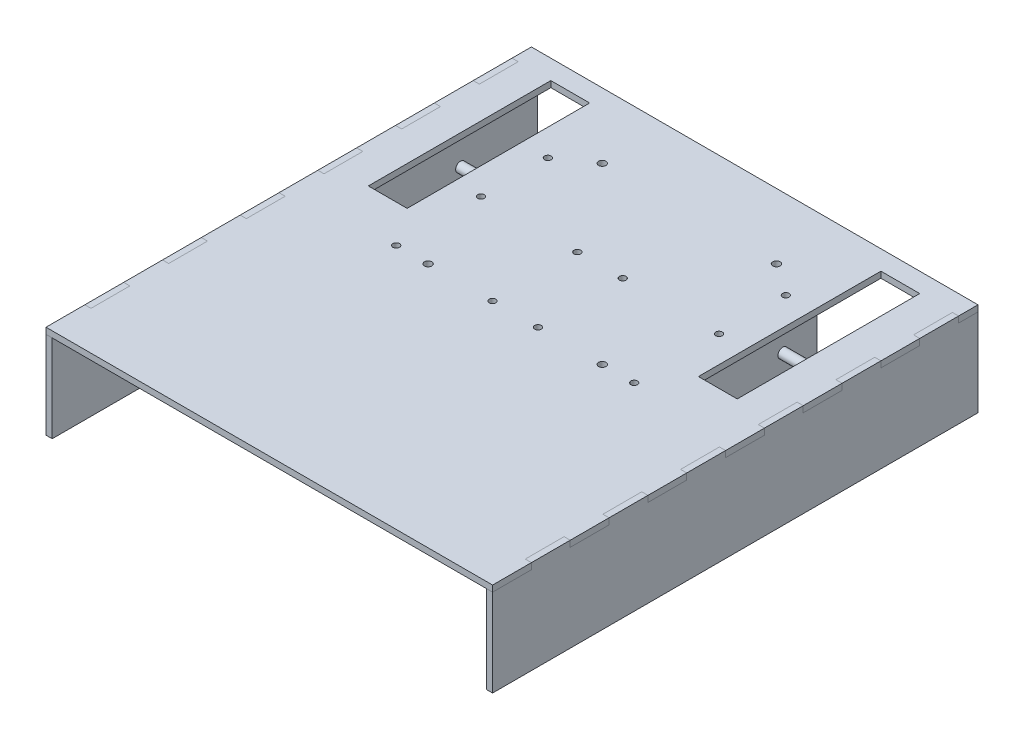
from build123d import *

# Parameters (mm, degrees)
SKETCH2_W           = 20
SKETCH2_H           = 94
BOSS_EXTRUDE1_DEPTH = 3.175
BOSS_EXTRUDE2_DEPTH = 3.175
BOSS_EXTRUDE3_DEPTH = 1.6129
SKETCH6_R           = 1.27
SKETCH6_R_2         = 2.3749
SKETCH6_R_3         = 2.55
BOSS_EXTRUDE4_DEPTH = 1.6129
SKETCH7_R           = 1.7
SKETCH7_R_2         = 1.9
CUT_EXTRUDE1_DEPTH  = 10
SKETCH9_R           = 2.5
BOSS_EXTRUDE6_DEPTH = 189


with BuildPart() as part:
    # Sketch2 → Boss-Extrude1 (new body)
    with BuildSketch(Plane(origin=(0, 0, 0), x_dir=(1, 0, 0), z_dir=(0, 1, 0))):
        Polygon((-172.266187111, -88.214102909), (57.733812889, -88.214102909), (57.733812889, -68.214102909), (54.558812889, -68.214102909), (54.558812889, -48.214102909), (57.733812889, -48.214102909), (57.733812889, -28.214102909), (54.558812889, -28.214102909), (54.558812889, -8.214102909), (57.733812889, -8.214102909), (57.733812889, 11.785897091), (54.558812889, 11.785897091), (54.558812889, 31.785897091), (57.733812889, 31.785897091), (57.733812889, 51.785897091), (54.558812889, 51.785897091), (54.558812889, 71.785897091), (57.733812889, 71.785897091), (57.733812889, 91.785897091), (54.558812889, 91.785897091), (54.558812889, 111.785897091), (57.733812889, 111.785897091), (57.733812889, 131.785897091), (54.558812889, 131.785897091), (54.558812889, 151.785897091), (57.733812889, 151.785897091), (57.733812889, 161.785897091), (-172.266187111, 161.785897091), (-172.266187111, 151.785897091), (-169.091187111, 151.785897091), (-169.091187111, 131.785897091), (-172.266187111, 131.785897091), (-172.266187111, 111.785897091), (-169.091187111, 111.785897091), (-169.091187111, 91.785897091), (-172.266187111, 91.785897091), (-172.266187111, 71.785897091), (-169.091187111, 71.785897091), (-169.091187111, 51.785897091), (-172.266187111, 51.785897091), (-172.266187111, 31.785897091), (-169.091187111, 31.785897091), (-169.091187111, 11.785897091), (-172.266187111, 11.785897091), (-172.266187111, -8.214102909), (-169.091187111, -8.214102909), (-169.091187111, -28.214102909), (-172.266187111, -28.214102909), (-172.266187111, -48.214102909), (-169.091187111, -48.214102909), (-169.091187111, -68.214102909), (-172.266187111, -68.214102909), align=None)
        with Locations((27.733812889, 104.785897091)):
            Rectangle(SKETCH2_W, SKETCH2_H, mode=Mode.SUBTRACT)
        with Locations((-142.266187111, 104.785897091)):
            Rectangle(SKETCH2_W, SKETCH2_H, mode=Mode.SUBTRACT)
    extrude(amount=BOSS_EXTRUDE1_DEPTH)


with BuildPart() as body_2:
    # Sketch3 → Boss-Extrude2 (new body)
    with BuildSketch(Plane.ZY.offset(169.091187111)):
        Polygon((68.214102909, 3.175), (68.214102909, 0), (88.214102909, 0), (88.214102909, -45), (-161.732040232, -45), (-161.732040232, 0), (-151.785897091, 0), (-151.785897091, 3.175), (-131.785897091, 3.175), (-131.785897091, 0), (-111.785897091, 0), (-111.785897091, 3.175), (-91.785897091, 3.175), (-91.785897091, 0), (-71.785897091, 0), (-71.785897091, 3.175), (-51.785897091, 3.175), (-51.785897091, 0), (-31.785897091, 0), (-31.785897091, 3.175), (-11.785897091, 3.175), (-11.785897091, 0), (8.214102909, 0), (8.214102909, 3.175), (28.214102909, 3.175), (28.214102909, 0), (48.214102909, 0), (48.214102909, 3.175), align=None)
    extrude(amount=BOSS_EXTRUDE2_DEPTH)


with BuildPart() as body_3:
    # Sketch4 → Boss-Extrude3 (new body)
    with BuildSketch(Plane.XZ):
        Polygon((-128.266187111, -122.812619878), (-128.266187111, -33.510319411), (-110.428738975, -33.510319411), (-110.428738975, -55.404375385), (-73.179527552, -55.404375385), (-73.179527552, -32.986733746), (-64.765041143, -32.986733746), (-64.765041143, -87.177277304), (-73.179527552, -87.177277304), (-73.179527552, -65.404375385), (-110.42560363, -65.404375385), (-110.42560363, -122.812619878), align=None)
    extrude(amount=BOSS_EXTRUDE3_DEPTH)

    # Sketch6 → Boss-Extrude4 (add)
    with BuildSketch(Plane(origin=(-128.266187111, 113.834921078, 0), x_dir=(0, -1, 0), z_dir=(1, 0, 0))):
        with BuildLine():
            Line((135.755040524, 122.812619878), (113.834921078, 122.812619878))
            Line((113.834921078, 122.812619878), (113.834921078, 33.510319411))
            Line((113.834921078, 33.510319411), (133.404101078, 33.510319411))
            ThreePointArc((133.404101078, 33.510319411), (151.380719154, 59.699448377), (135.755040524, 87.355685301))
            Line((135.755040524, 87.355685301), (135.755040524, 122.812619878))
        make_face()
        with Locations((123.193301078, 51.685825385)):
            Circle(SKETCH6_R, mode=Mode.SUBTRACT)
        with Locations((133.404101078, 51.685825385)):
            Circle(SKETCH6_R_2, mode=Mode.SUBTRACT)
        with Locations((143.614901078, 51.685825385)):
            Circle(SKETCH6_R, mode=Mode.SUBTRACT)
        with Locations((133.404101078, 73.860025385)):
            Circle(SKETCH6_R, mode=Mode.SUBTRACT)
        with Locations((125.834921078, 105.254818177)):
            Circle(SKETCH6_R_3, mode=Mode.SUBTRACT)
    extrude(amount=BOSS_EXTRUDE4_DEPTH)


with BuildPart() as cut_extrude1_tool:
    # Sketch7 → Cut-Extrude1 (new body)
    with BuildSketch(Plane.XZ.offset(1.6129)):
        with Locations((-118.541013043, -82.124992621)):
            Circle(SKETCH7_R)
        with Locations((-118.541013043, -38.429929163)):
            Circle(SKETCH7_R)
        with Locations((-68.972284348, -38.429929163)):
            Circle(SKETCH7_R)
        with Locations((-68.972284348, -82.124992621)):
            Circle(SKETCH7_R)
        with Locations((-118.541013043, -116.547553094)):
            Circle(SKETCH7_R)
        with Locations((-102.118387528, -38.429929163)):
            Circle(SKETCH7_R_2)
        with Locations((-102.118387528, -128.129929163)):
            Circle(SKETCH7_R_2)
    cut_extrude1 = extrude(amount=-CUT_EXTRUDE1_DEPTH)


with BuildPart() as part_1:
    add(part.part)

    # Cut-Extrude1: cut by cut_extrude1_tool
    add(cut_extrude1_tool.part, mode=Mode.SUBTRACT)

    # Mirror2: Cut-Extrude1 across plane
    add(cut_extrude1.mirror(Plane.ZY.offset(57.266187111)), mode=Mode.SUBTRACT)


with BuildPart() as body_3_1:
    add(body_3.part)

    # Cut-Extrude1: cut by cut_extrude1_tool
    add(cut_extrude1_tool.part, mode=Mode.SUBTRACT)


with BuildPart() as body_4:
    # Mirror1: mirrored copy
    add(body_3_1.part.mirror(Plane.ZY.offset(57.266187111)))


with BuildPart() as body_5:
    # Mirror1 2: mirrored copy
    add(body_2.part.mirror(Plane.ZY.offset(57.266187111)))


with BuildPart() as body_6:
    # Sketch9 → Boss-Extrude6 (new body)
    with BuildSketch(Plane(origin=(-152.266187111, 0, 0), x_dir=(0, 0, -1), z_dir=(1, 0, 0))):
        with Locations((105.254818177, -12)):
            Circle(SKETCH9_R)
    extrude(amount=BOSS_EXTRUDE6_DEPTH)


solid = Compound([body_2.part, part_1.part, body_3_1.part, body_4.part, body_5.part, body_6.part])
